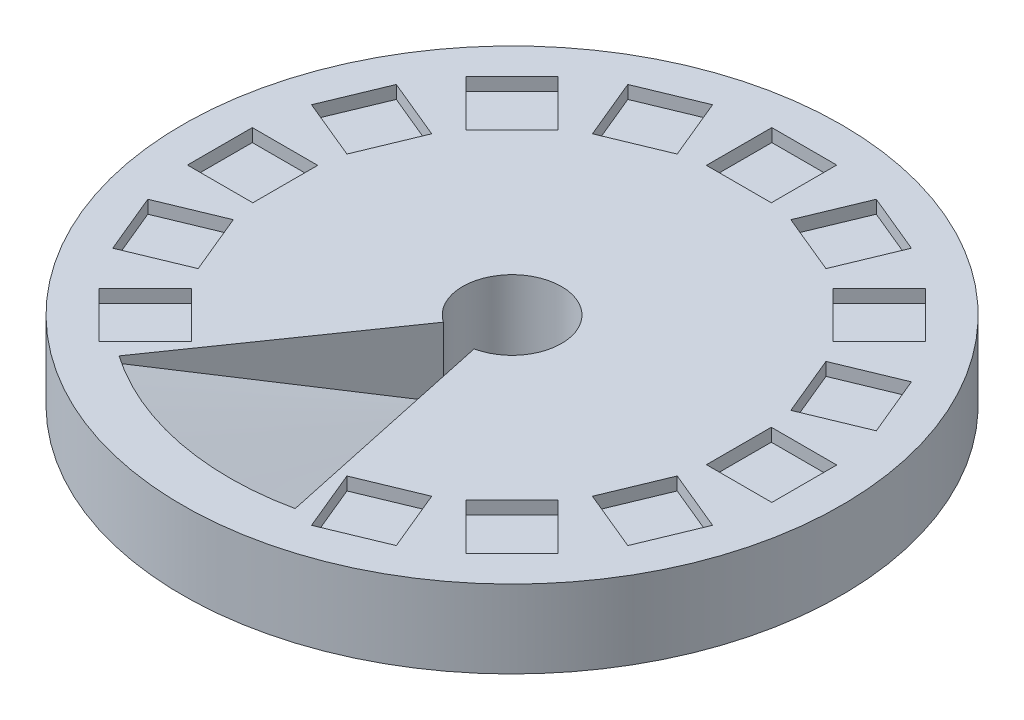
from build123d import *

# Parameters (mm, degrees)
SKETCH3_W          = 12.5
SKETCH3_H          = 12.6
CUT_EXTRUDE1_DEPTH = 2.5
CIRPATTERN1_COUNT  = 16
CUT_SWEEP3_ANGLE   = 46.890766
SKETCH8_R          = 27
SKETCH8_R_2        = 19.043703719
CUT_EXTRUDE2_DEPTH = 1.85


# Read off the part's stored shape, not the designer's step: Cut-Sweep3
with BuildPart() as part:
    # Sketch1 → Revolve1 (revolve)
    with BuildSketch(Plane(origin=(0, 0, 0), x_dir=(0, 0, -1), z_dir=(1, 0, 0))):
        Polygon((9.525, 0), (63.5, 0), (63.5, -15), (19.047086271, -15), (19.047086271, -34.735580232), (16.547086271, -34.735580232), (16.547086271, -37.235580232), (19.047086271, -37.235580232), (19.047086271, -40.235580232), (9.525, -40), align=None)
    revolve(axis=Axis((0, 0, 0), (0, 1, 0)))

    # Sketch3 → Cut-Extrude1 (cut)
    with BuildSketch(Plane(origin=(0, 0, 0), x_dir=(1, 0, 0), z_dir=(0, 1, 0))):
        with Locations((0, 50)):
            Rectangle(SKETCH3_W, SKETCH3_H)
    cut_extrude1 = extrude(amount=-CUT_EXTRUDE1_DEPTH, mode=Mode.SUBTRACT)

    # CirPattern1: Cut-Extrude1 ×16 about axis, 2 skipped
    cirpattern1_axis = Axis((0, 0, 0), (0, -1, 0))
    add([cut_extrude1.rotate(cirpattern1_axis, i * 360 / CIRPATTERN1_COUNT) for i in range(1, CIRPATTERN1_COUNT) if i not in (8, 9)], mode=Mode.SUBTRACT)

    # Cut-Sweep3 outline → Cut-Sweep3 (revolve, cut)
    with BuildSketch(Plane(origin=(0, 0, 0), x_dir=(-0.5705578043075055, 0, 0.8212574455941318), z_dir=(-0.8212574455941318, 0, -0.5705578043075055))):
        Polygon((54.406189133, -1.25), (54.406189133, 0), (9.525, 0), (9.525, -13.378851836), align=None)
    revolve(axis=Axis((0, 0, 0), (0, 1, 0)), revolution_arc=CUT_SWEEP3_ANGLE, mode=Mode.SUBTRACT)

    # Sketch8 → Cut-Extrude2 (cut)
    with BuildSketch(Plane.XZ.offset(15)):
        with Locations(Location((0, 0, 0), (0, 0, 270))):
            Circle(SKETCH8_R)
        with Locations(Location((0, 0, 0), (0, 0, 270))):
            Circle(SKETCH8_R_2, mode=Mode.SUBTRACT)
    extrude(amount=-CUT_EXTRUDE2_DEPTH, mode=Mode.SUBTRACT)


solid = part.part
